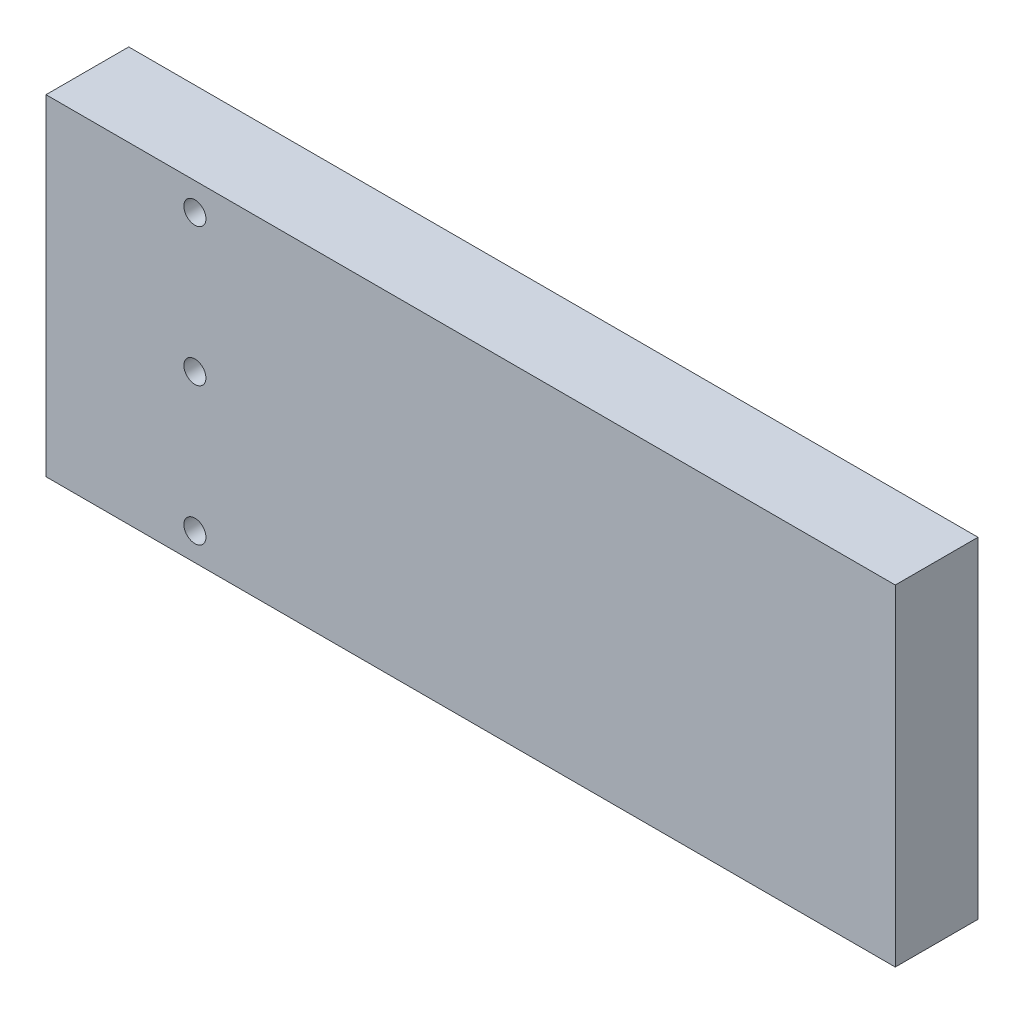
from build123d import *

# Parameters (mm, degrees)
ESQUISSE1_W        = 154
ESQUISSE1_H        = 60
ESQUISSE1_R        = 2
BOSS_EXTRU_1_DEPTH = 15


with BuildPart() as part:
    # Esquisse1 → Boss.-Extru.1 (new body)
    with BuildSketch(Plane.XY):
        with Locations((77, -30)):
            Rectangle(ESQUISSE1_W, ESQUISSE1_H)
        with Locations((27, -55)):
            Circle(ESQUISSE1_R, mode=Mode.SUBTRACT)
        with Locations((27, -30)):
            Circle(ESQUISSE1_R, mode=Mode.SUBTRACT)
        with Locations((27, -5)):
            Circle(ESQUISSE1_R, mode=Mode.SUBTRACT)
    extrude(amount=BOSS_EXTRU_1_DEPTH)


solid = part.part
